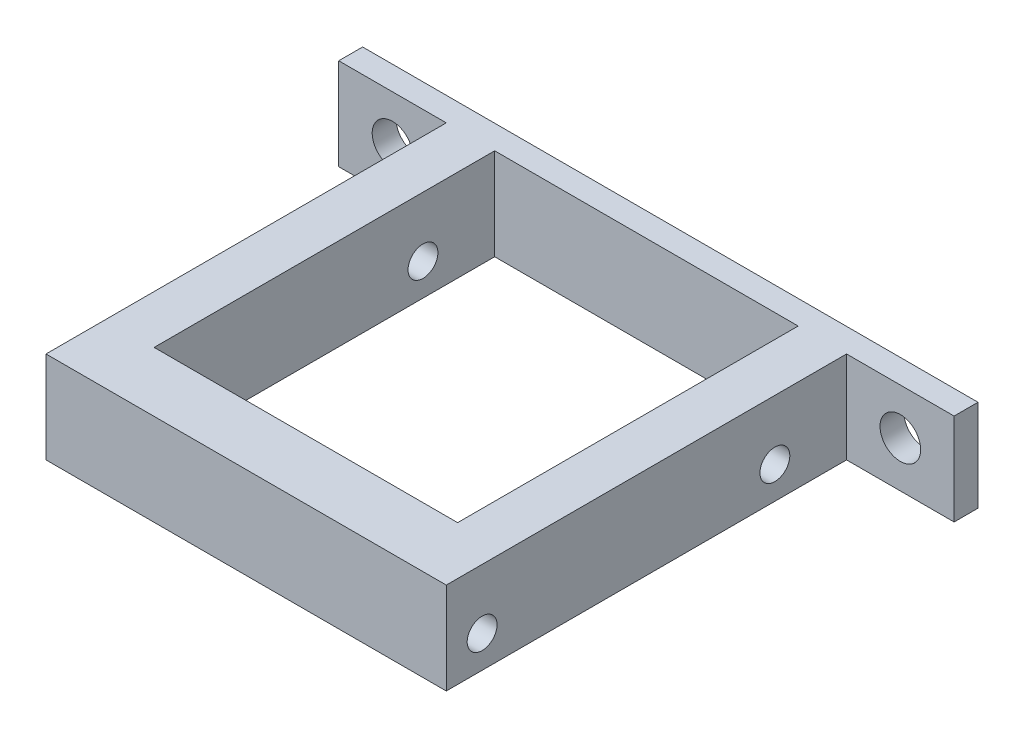
from build123d import *

# Parameters (mm, degrees)
SKETCH25_W                          = 25.4
SKETCH25_H                          = 28.5
BOSS_EXTRUDE5_DEPTH                 = 7.68
M3X0_5_TAPPED_HOLE2_D               = 2.5
M3X0_5_TAPPED_HOLE2_DEPTH           = 7.62
M3X0_5_TAPPED_HOLE2_TIP             = 0.751075774
M3X0_5_TAPPED_HOLE2_ON_FACE_2_D     = 2.5
M3X0_5_TAPPED_HOLE2_ON_FACE_2_DEPTH = 7.62
M3X0_5_TAPPED_HOLE2_ON_FACE_2_TIP   = 0.751075774
M3_CLEARANCE_HOLE3_D                = 3.4


with BuildPart() as part:
    # Sketch25 → Boss-Extrude5 (new body)
    with BuildSketch(Plane(origin=(0, 0, 0), x_dir=(1, 0, 0), z_dir=(0, 1, 0))):
        Polygon((25.75, 28.75), (-25.75, 28.75), (-25.75, 26.75), (-16.75, 26.75), (-16.75, -6.75), (16.75, -6.75), (16.75, 26.75), (25.75, 26.75), align=None)
        with Locations((0, 12.5)):
            Rectangle(SKETCH25_W, SKETCH25_H, mode=Mode.SUBTRACT)
    extrude(amount=-BOSS_EXTRUDE5_DEPTH)

    # M3x0.5 Tapped Hole2
    with Locations(Plane(origin=(16.75, -5, 3.75), x_dir=(0, 0, 1), z_dir=(1, 0, 0))):
        with Locations((0, 0), (-24.5, 0)):
            Hole(M3X0_5_TAPPED_HOLE2_D / 2, depth=M3X0_5_TAPPED_HOLE2_DEPTH)
            with Locations((0, 0, -(M3X0_5_TAPPED_HOLE2_DEPTH + M3X0_5_TAPPED_HOLE2_TIP / 2))):  # 118° drill point
                Cone(0, M3X0_5_TAPPED_HOLE2_D / 2, M3X0_5_TAPPED_HOLE2_TIP, mode=Mode.SUBTRACT)

    # M3x0.5 Tapped Hole2 on face 2
    with Locations(Plane(origin=(-16.75, -5, -20.75), x_dir=(0, 0, -1), z_dir=(-1, 0, 0))):
        with Locations((0, 0), (-24.5, 0)):
            Hole(M3X0_5_TAPPED_HOLE2_ON_FACE_2_D / 2, depth=M3X0_5_TAPPED_HOLE2_ON_FACE_2_DEPTH)
            with Locations((0, 0, -(M3X0_5_TAPPED_HOLE2_ON_FACE_2_DEPTH + M3X0_5_TAPPED_HOLE2_ON_FACE_2_TIP / 2))):  # 118° drill point
                Cone(0, M3X0_5_TAPPED_HOLE2_ON_FACE_2_D / 2, M3X0_5_TAPPED_HOLE2_ON_FACE_2_TIP, mode=Mode.SUBTRACT)

    # M3 Clearance Hole3 (through all)
    with Locations(Plane(origin=(21.25, -3.84, -26.75), x_dir=(1, 0, 0), z_dir=(0, 0, 1))):
        with Locations((0, 0), (-42.5, 0)):
            Hole(M3_CLEARANCE_HOLE3_D / 2)


solid = part.part
